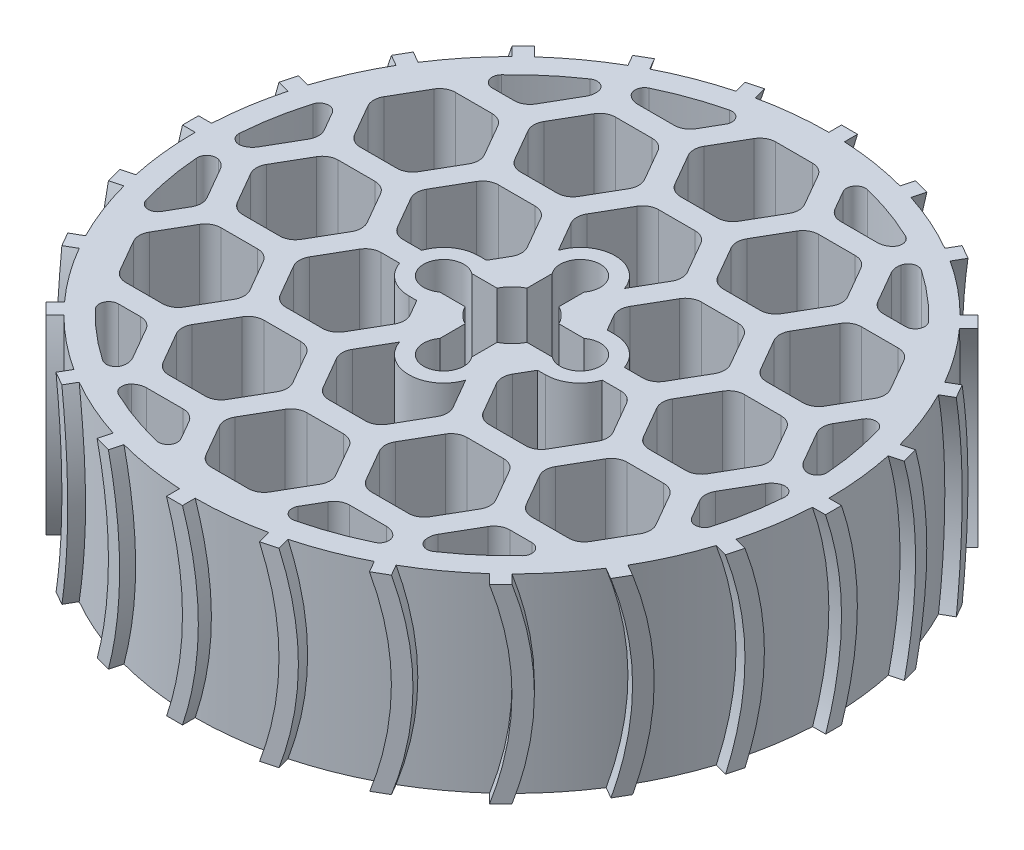
from build123d import *

# Parameters (mm, degrees)
SKETCH3_R           = 100
BOSS_EXTRUDE1_DEPTH = 60
SKETCH3_3_R         = 6.338999989
SKETCH3_3_R_2       = 3.302
BOSS_EXTRUDE2_DEPTH = 30
FILLET2_R           = 3
BOSS_EXTRUDE3_START = -2
BOSS_EXTRUDE3_DEPTH = 6
CIRPATTERN1_COUNT   = 24


with BuildPart() as part:
    # Sketch3 → Boss-Extrude1 (new body)
    with BuildSketch(Plane(origin=(0, 0, 0), x_dir=(1, 0, 0), z_dir=(0, 1, 0))):
        Circle(SKETCH3_R)
        with BuildLine():
            Line((9.767988863, 5.058299474), (17.727459802, 5.058299474))
            ThreePointArc((17.72745979, 5.05829949), (27.886999941, 1.2e-08), (17.727459809, -5.058299505))
            Line((17.727459783, -5.05829954), (9.767988829, -5.05829954))
            ThreePointArc((9.767988829, -5.05829954), (7.778174567, -7.778174619), (5.058299474, -9.767988863))
            Line((5.058299474, -9.767988863), (5.058299474, -17.727459802))
            ThreePointArc((5.05829949, -17.72745979), (1.2e-08, -27.886999941), (-5.058299505, -17.727459809))
            Line((-5.05829954, -17.727459783), (-5.05829954, -9.767988829))
            ThreePointArc((-5.05829954, -9.767988829), (-7.778174619, -7.778174567), (-9.767988863, -5.058299474))
            Line((-9.767988863, -5.058299474), (-17.727459802, -5.058299474))
            ThreePointArc((-17.72745979, -5.05829949), (-27.886999941, -1.2e-08), (-17.727459809, 5.058299505))
            Line((-17.727459783, 5.05829954), (-9.767988829, 5.05829954))
            ThreePointArc((-9.767988829, 5.05829954), (-7.778174567, 7.778174619), (-5.058299474, 9.767988863))
            Line((-5.058299474, 9.767988863), (-5.058299474, 17.727459802))
            ThreePointArc((-5.05829949, 17.72745979), (-1.2e-08, 27.886999941), (5.058299505, 17.727459809))
            Line((5.05829954, 17.727459783), (5.05829954, 9.767988829))
            ThreePointArc((5.05829954, 9.767988829), (7.778174619, 7.778174567), (9.767988863, 5.058299474))
        make_face(mode=Mode.SUBTRACT)
        with BuildLine():
            ThreePointArc((10.425269447, 25.057096364), (-7e-09, 32.547999916), (-10.425269391, 25.057096268))
            Line((-10.425269391, 25.057096268), (-15.877132403, 34.5))
            ThreePointArc((-15.877132403, 34.5), (-16.547005384, 37), (-15.877132403, 39.5))
            Line((-15.877132403, 39.5), (-10.103629711, 49.5))
            ThreePointArc((-10.103629711, 49.5), (-8.273502692, 51.330127019), (-5.773502692, 52))
            Line((-5.773502692, 52), (5.773502692, 52))
            ThreePointArc((5.773502692, 52), (8.273502692, 51.330127019), (10.103629711, 49.5))
            Line((10.103629711, 49.5), (15.877132403, 39.5))
            ThreePointArc((15.877132403, 39.5), (16.547005384, 37), (15.877132403, 34.5))
            Line((15.877132403, 34.5), (10.425269447, 25.057096364))
        make_face(mode=Mode.SUBTRACT)
        with BuildLine():
            ThreePointArc((86.025190109, 31), (86.543723708, 31.736009208), (87.185842375, 32.367095782))
            ThreePointArc((87.185842375, 32.367095782), (91.209249511, 18.162400823), (92.934116448, 3.5))
            Line((92.934116448, 3.5), (90.355317128, 3.5))
            ThreePointArc((90.355317128, 3.5), (87.855317128, 4.169872981), (86.025190109, 6))
            Line((86.025190109, 6), (80.251687417, 16))
            ThreePointArc((80.251687417, 16), (79.581814436, 18.5), (80.251687417, 21))
            Line((80.251687417, 21), (86.025190109, 31))
        make_face(mode=Mode.SUBTRACT)
        with BuildLine():
            Line((90.355317128, -3.5), (92.934116448, -3.5))
            ThreePointArc((92.934116448, -3.5), (91.209249511, -18.162400823), (87.185842375, -32.367095782))
            ThreePointArc((87.185842375, -32.367095782), (86.543723707, -31.736009208), (86.025190109, -31))
            Line((86.025190109, -31), (80.251687417, -21))
            ThreePointArc((80.251687417, -21), (79.581814436, -18.5), (80.251687417, -16))
            Line((80.251687417, -16), (86.025190109, -6))
            ThreePointArc((86.025190109, -6), (87.855317128, -4.169872981), (90.355317128, -3.5))
        make_face(mode=Mode.SUBTRACT)
        with BuildLine():
            ThreePointArc((69.859382572, -59), (70.756052043, -59.081058665), (71.623648382, -59.321606456))
            ThreePointArc((71.623648382, -59.321606456), (61.333725262, -69.908326725), (49.498147137, -78.733305722))
            Line((49.498147137, -78.733305722), (48.208747477, -76.5))
            ThreePointArc((48.208747477, -76.5), (47.538874496, -74), (48.208747477, -71.5))
            Line((48.208747477, -71.5), (53.982250169, -61.5))
            ThreePointArc((53.982250169, -61.5), (55.812377188, -59.669872981), (58.312377188, -59))
            Line((58.312377188, -59), (69.859382572, -59))
        make_face(mode=Mode.SUBTRACT)
        with BuildLine():
            Line((42.146569651, -80), (43.435969311, -82.233305722))
            ThreePointArc((43.435969311, -82.233305722), (29.875524249, -88.070727548), (15.562193993, -91.688702238))
            ThreePointArc((15.562193993, -91.688702238), (15.787671665, -90.817067873), (16.165807537, -90))
            Line((16.165807537, -90), (21.939310229, -80))
            ThreePointArc((21.939310229, -80), (23.769437248, -78.169872981), (26.269437248, -77.5))
            Line((26.269437248, -77.5), (37.816442632, -77.5))
            ThreePointArc((37.816442632, -77.5), (40.316442632, -78.169872981), (42.146569651, -80))
        make_face(mode=Mode.SUBTRACT)
        with BuildLine():
            ThreePointArc((-16.165807537, -90), (-15.787671665, -90.817067873), (-15.562193993, -91.688702238))
            ThreePointArc((-15.562193993, -91.688702238), (-29.875524249, -88.070727548), (-43.435969311, -82.233305722))
            Line((-43.435969311, -82.233305722), (-42.146569651, -80))
            ThreePointArc((-42.146569651, -80), (-40.316442632, -78.169872981), (-37.816442632, -77.5))
            Line((-37.816442632, -77.5), (-26.269437248, -77.5))
            ThreePointArc((-26.269437248, -77.5), (-23.769437248, -78.169872981), (-21.939310229, -80))
            Line((-21.939310229, -80), (-16.165807537, -90))
        make_face(mode=Mode.SUBTRACT)
        with BuildLine():
            Line((-48.208747477, -76.5), (-49.498147137, -78.733305722))
            ThreePointArc((-49.498147137, -78.733305722), (-61.333725262, -69.908326725), (-71.623648382, -59.321606456))
            ThreePointArc((-71.623648382, -59.321606456), (-70.756052043, -59.081058665), (-69.859382572, -59))
            Line((-69.859382572, -59), (-58.312377188, -59))
            ThreePointArc((-58.312377188, -59), (-55.812377188, -59.669872981), (-53.982250169, -61.5))
            Line((-53.982250169, -61.5), (-48.208747477, -71.5))
            ThreePointArc((-48.208747477, -71.5), (-47.538874496, -74), (-48.208747477, -76.5))
        make_face(mode=Mode.SUBTRACT)
        with BuildLine():
            ThreePointArc((-86.025190109, -31), (-86.543723708, -31.736009208), (-87.185842375, -32.367095782))
            ThreePointArc((-87.185842375, -32.367095782), (-91.209249511, -18.162400823), (-92.934116448, -3.5))
            Line((-92.934116448, -3.5), (-90.355317128, -3.5))
            ThreePointArc((-90.355317128, -3.5), (-87.855317128, -4.169872981), (-86.025190109, -6))
            Line((-86.025190109, -6), (-80.251687417, -16))
            ThreePointArc((-80.251687417, -16), (-79.581814436, -18.5), (-80.251687417, -21))
            Line((-80.251687417, -21), (-86.025190109, -31))
        make_face(mode=Mode.SUBTRACT)
        with BuildLine():
            Line((-90.355317128, 3.5), (-92.934116448, 3.5))
            ThreePointArc((-92.934116448, 3.5), (-91.209249511, 18.162400823), (-87.185842375, 32.367095782))
            ThreePointArc((-87.185842375, 32.367095782), (-86.543723707, 31.736009208), (-86.025190109, 31))
            Line((-86.025190109, 31), (-80.251687417, 21))
            ThreePointArc((-80.251687417, 21), (-79.581814436, 18.5), (-80.251687417, 16))
            Line((-80.251687417, 16), (-86.025190109, 6))
            ThreePointArc((-86.025190109, 6), (-87.855317128, 4.169872981), (-90.355317128, 3.5))
        make_face(mode=Mode.SUBTRACT)
        with BuildLine():
            ThreePointArc((-69.859382572, 59), (-70.756052043, 59.081058665), (-71.623648382, 59.321606456))
            ThreePointArc((-71.623648382, 59.321606456), (-61.333725262, 69.908326725), (-49.498147137, 78.733305722))
            Line((-49.498147137, 78.733305722), (-48.208747477, 76.5))
            ThreePointArc((-48.208747477, 76.5), (-47.538874496, 74), (-48.208747477, 71.5))
            Line((-48.208747477, 71.5), (-53.982250169, 61.5))
            ThreePointArc((-53.982250169, 61.5), (-55.812377188, 59.669872981), (-58.312377188, 59))
            Line((-58.312377188, 59), (-69.859382572, 59))
        make_face(mode=Mode.SUBTRACT)
        with BuildLine():
            Line((-42.146569651, 80), (-43.435969311, 82.233305722))
            ThreePointArc((-43.435969311, 82.233305722), (-29.875524249, 88.070727548), (-15.562193993, 91.688702238))
            ThreePointArc((-15.562193993, 91.688702238), (-15.787671665, 90.817067873), (-16.165807537, 90))
            Line((-16.165807537, 90), (-21.939310229, 80))
            ThreePointArc((-21.939310229, 80), (-23.769437248, 78.169872981), (-26.269437248, 77.5))
            Line((-26.269437248, 77.5), (-37.816442632, 77.5))
            ThreePointArc((-37.816442632, 77.5), (-40.316442632, 78.169872981), (-42.146569651, 80))
        make_face(mode=Mode.SUBTRACT)
        with BuildLine():
            ThreePointArc((16.165807537, 90), (15.787671665, 90.817067873), (15.562193993, 91.688702238))
            ThreePointArc((15.562193993, 91.688702238), (29.875524249, 88.070727548), (43.435969311, 82.233305722))
            Line((43.435969311, 82.233305722), (42.146569651, 80))
            ThreePointArc((42.146569651, 80), (40.316442632, 78.169872981), (37.816442632, 77.5))
            Line((37.816442632, 77.5), (26.269437248, 77.5))
            ThreePointArc((26.269437248, 77.5), (23.769437248, 78.169872981), (21.939310229, 80))
            Line((21.939310229, 80), (16.165807537, 90))
        make_face(mode=Mode.SUBTRACT)
        with BuildLine():
            Line((48.208747477, 76.5), (49.498147137, 78.733305722))
            ThreePointArc((49.498147137, 78.733305722), (61.333725262, 69.908326725), (71.623648382, 59.321606456))
            ThreePointArc((71.623648382, 59.321606456), (70.756052043, 59.081058665), (69.859382572, 59))
            Line((69.859382572, 59), (58.312377188, 59))
            ThreePointArc((58.312377188, 59), (55.812377188, 59.669872981), (53.982250169, 61.5))
            Line((53.982250169, 61.5), (48.208747477, 71.5))
            ThreePointArc((48.208747477, 71.5), (47.538874496, 74), (48.208747477, 76.5))
        make_face(mode=Mode.SUBTRACT)
        with BuildLine():
            Line((-26.269437248, -70.5), (-37.816442632, -70.5))
            ThreePointArc((-37.816442632, -70.5), (-40.316442632, -69.830127019), (-42.146569651, -68))
            Line((-42.146569651, -68), (-47.920072343, -58))
            ThreePointArc((-47.920072343, -58), (-48.589945324, -55.5), (-47.920072343, -53))
            Line((-47.920072343, -53), (-42.146569651, -43))
            ThreePointArc((-42.146569651, -43), (-40.316442632, -41.169872981), (-37.816442632, -40.5))
            Line((-37.816442632, -40.5), (-26.269437248, -40.5))
            ThreePointArc((-26.269437248, -40.5), (-23.769437248, -41.169872981), (-21.939310229, -43))
            Line((-21.939310229, -43), (-16.165807537, -53))
            ThreePointArc((-16.165807537, -53), (-15.495934556, -55.5), (-16.165807537, -58))
            Line((-16.165807537, -58), (-21.939310229, -68))
            ThreePointArc((-21.939310229, -68), (-23.769437248, -69.830127019), (-26.269437248, -70.5))
        make_face(mode=Mode.SUBTRACT)
        with BuildLine():
            Line((15.877132403, -76.5), (10.103629711, -86.5))
            ThreePointArc((10.103629711, -86.5), (8.273502692, -88.330127019), (5.773502692, -89))
            Line((5.773502692, -89), (-5.773502692, -89))
            ThreePointArc((-5.773502692, -89), (-8.273502692, -88.330127019), (-10.103629711, -86.5))
            Line((-10.103629711, -86.5), (-15.877132403, -76.5))
            ThreePointArc((-15.877132403, -76.5), (-16.547005384, -74), (-15.877132403, -71.5))
            Line((-15.877132403, -71.5), (-10.103629711, -61.5))
            ThreePointArc((-10.103629711, -61.5), (-8.273502692, -59.669872981), (-5.773502692, -59))
            Line((-5.773502692, -59), (5.773502692, -59))
            ThreePointArc((5.773502692, -59), (8.273502692, -59.669872981), (10.103629711, -61.5))
            Line((10.103629711, -61.5), (15.877132403, -71.5))
            ThreePointArc((15.877132403, -71.5), (16.547005384, -74), (15.877132403, -76.5))
        make_face(mode=Mode.SUBTRACT)
        with BuildLine():
            Line((-58.312377188, -52), (-69.859382572, -52))
            ThreePointArc((-69.859382572, -52), (-72.359382572, -51.330127019), (-74.189509591, -49.5))
            Line((-74.189509591, -49.5), (-79.963012283, -39.5))
            ThreePointArc((-79.963012283, -39.5), (-80.632885264, -37), (-79.963012283, -34.5))
            Line((-79.963012283, -34.5), (-74.189509591, -24.5))
            ThreePointArc((-74.189509591, -24.5), (-72.359382572, -22.669872981), (-69.859382572, -22))
            Line((-69.859382572, -22), (-58.312377188, -22))
            ThreePointArc((-58.312377188, -22), (-55.812377188, -22.669872981), (-53.982250169, -24.5))
            Line((-53.982250169, -24.5), (-48.208747477, -34.5))
            ThreePointArc((-48.208747477, -34.5), (-47.538874496, -37), (-48.208747477, -39.5))
            Line((-48.208747477, -39.5), (-53.982250169, -49.5))
            ThreePointArc((-53.982250169, -49.5), (-55.812377188, -51.330127019), (-58.312377188, -52))
        make_face(mode=Mode.SUBTRACT)
        with BuildLine():
            Line((-74.189509591, -12.5), (-79.963012283, -2.5))
            ThreePointArc((-79.963012283, -2.5), (-80.632885264, 0), (-79.963012283, 2.5))
            Line((-79.963012283, 2.5), (-74.189509591, 12.5))
            ThreePointArc((-74.189509591, 12.5), (-72.359382572, 14.330127019), (-69.859382572, 15))
            Line((-69.859382572, 15), (-58.312377188, 15))
            ThreePointArc((-58.312377188, 15), (-55.812377188, 14.330127019), (-53.982250169, 12.5))
            Line((-53.982250169, 12.5), (-48.208747477, 2.5))
            ThreePointArc((-48.208747477, 2.5), (-47.538874496, 0), (-48.208747477, -2.5))
            Line((-48.208747477, -2.5), (-53.982250169, -12.5))
            ThreePointArc((-53.982250169, -12.5), (-55.812377188, -14.330127019), (-58.312377188, -15))
            Line((-58.312377188, -15), (-69.859382572, -15))
            ThreePointArc((-69.859382572, -15), (-72.359382572, -14.330127019), (-74.189509591, -12.5))
        make_face(mode=Mode.SUBTRACT)
        with BuildLine():
            Line((47.920072343, -58), (42.146569651, -68))
            ThreePointArc((42.146569651, -68), (40.316442632, -69.830127019), (37.816442632, -70.5))
            Line((37.816442632, -70.5), (26.269437248, -70.5))
            ThreePointArc((26.269437248, -70.5), (23.769437248, -69.830127019), (21.939310229, -68))
            Line((21.939310229, -68), (16.165807537, -58))
            ThreePointArc((16.165807537, -58), (15.495934556, -55.5), (16.165807537, -53))
            Line((16.165807537, -53), (21.939310229, -43))
            ThreePointArc((21.939310229, -43), (23.769437248, -41.169872981), (26.269437248, -40.5))
            Line((26.269437248, -40.5), (37.816442632, -40.5))
            ThreePointArc((37.816442632, -40.5), (40.316442632, -41.169872981), (42.146569651, -43))
            Line((42.146569651, -43), (47.920072343, -53))
            ThreePointArc((47.920072343, -53), (48.589945324, -55.5), (47.920072343, -58))
        make_face(mode=Mode.SUBTRACT)
        with BuildLine():
            ThreePointArc((79.963012283, 39.5), (80.632885264, 37), (79.963012283, 34.5))
            Line((79.963012283, 34.5), (74.189509591, 24.5))
            ThreePointArc((74.189509591, 24.5), (72.359382572, 22.669872981), (69.859382572, 22))
            Line((69.859382572, 22), (58.312377188, 22))
            ThreePointArc((58.312377188, 22), (55.812377188, 22.669872981), (53.982250169, 24.5))
            Line((53.982250169, 24.5), (48.208747477, 34.5))
            ThreePointArc((48.208747477, 34.5), (47.538874496, 37), (48.208747477, 39.5))
            Line((48.208747477, 39.5), (53.982250169, 49.5))
            ThreePointArc((53.982250169, 49.5), (55.812377188, 51.330127019), (58.312377188, 52))
            Line((58.312377188, 52), (69.859382572, 52))
            ThreePointArc((69.859382572, 52), (72.359382572, 51.330127019), (74.189509591, 49.5))
            Line((74.189509591, 49.5), (79.963012283, 39.5))
        make_face(mode=Mode.SUBTRACT)
        with BuildLine():
            Line((-16.165807537, 16), (-19.052558858, 11.000000044))
            Line((-19.052558858, 11.000000044), (-21.547999916, 11.000000044))
            ThreePointArc((-21.547999916, 11.000000044), (-27.970616224, 8.93028558), (-31.976326738, 3.5))
            Line((-31.976326738, 3.5), (-37.816442632, 3.5))
            ThreePointArc((-37.816442632, 3.5), (-40.316442632, 4.169872981), (-42.146569651, 6))
            Line((-42.146569651, 6), (-47.920072343, 16))
            ThreePointArc((-47.920072343, 16), (-48.589945324, 18.5), (-47.920072343, 21))
            Line((-47.920072343, 21), (-42.146569651, 31))
            ThreePointArc((-42.146569651, 31), (-40.316442632, 32.830127019), (-37.816442632, 33.5))
            Line((-37.816442632, 33.5), (-26.269437248, 33.5))
            ThreePointArc((-26.269437248, 33.5), (-23.769437248, 32.830127019), (-21.939310229, 31))
            Line((-21.939310229, 31), (-16.165807537, 21))
            ThreePointArc((-16.165807537, 21), (-15.495934556, 18.5), (-16.165807537, 16))
        make_face(mode=Mode.SUBTRACT)
        with BuildLine():
            Line((-37.816442632, -3.5), (-31.976326709, -3.5))
            ThreePointArc((-31.976326709, -3.5), (-27.970616186, -8.930285519), (-21.547999916, -10.999999956))
            Line((-21.547999916, -10.999999956), (-19.052558909, -10.999999956))
            Line((-19.052558909, -10.999999956), (-16.165807537, -16))
            ThreePointArc((-16.165807537, -16), (-15.495934556, -18.5), (-16.165807537, -21))
            Line((-16.165807537, -21), (-21.939310229, -31))
            ThreePointArc((-21.939310229, -31), (-23.769437248, -32.830127019), (-26.269437248, -33.5))
            Line((-26.269437248, -33.5), (-37.816442632, -33.5))
            ThreePointArc((-37.816442632, -33.5), (-40.316442632, -32.830127019), (-42.146569651, -31))
            Line((-42.146569651, -31), (-47.920072343, -21))
            ThreePointArc((-47.920072343, -21), (-48.589945324, -18.5), (-47.920072343, -16))
            Line((-47.920072343, -16), (-42.146569651, -6))
            ThreePointArc((-42.146569651, -6), (-40.316442632, -4.169872981), (-37.816442632, -3.5))
        make_face(mode=Mode.SUBTRACT)
        with BuildLine():
            Line((-15.877132403, -34.5), (-10.425269447, -25.057096364))
            ThreePointArc((-10.425269447, -25.057096364), (7e-09, -32.547999916), (10.425269391, -25.057096268))
            Line((10.425269391, -25.057096268), (15.877132403, -34.5))
            ThreePointArc((15.877132403, -34.5), (16.547005384, -37), (15.877132403, -39.5))
            Line((15.877132403, -39.5), (10.103629711, -49.5))
            ThreePointArc((10.103629711, -49.5), (8.273502692, -51.330127019), (5.773502692, -52))
            Line((5.773502692, -52), (-5.773502692, -52))
            ThreePointArc((-5.773502692, -52), (-8.273502692, -51.330127019), (-10.103629711, -49.5))
            Line((-10.103629711, -49.5), (-15.877132403, -39.5))
            ThreePointArc((-15.877132403, -39.5), (-16.547005384, -37), (-15.877132403, -34.5))
        make_face(mode=Mode.SUBTRACT)
        with BuildLine():
            Line((16.165807537, -16), (19.052558858, -11.000000044))
            Line((19.052558858, -11.000000044), (21.547999916, -11.000000044))
            ThreePointArc((21.547999916, -11.000000044), (27.970616224, -8.93028558), (31.976326738, -3.5))
            Line((31.976326738, -3.5), (37.816442632, -3.5))
            ThreePointArc((37.816442632, -3.5), (40.316442632, -4.169872981), (42.146569651, -6))
            Line((42.146569651, -6), (47.920072343, -16))
            ThreePointArc((47.920072343, -16), (48.589945324, -18.5), (47.920072343, -21))
            Line((47.920072343, -21), (42.146569651, -31))
            ThreePointArc((42.146569651, -31), (40.316442632, -32.830127019), (37.816442632, -33.5))
            Line((37.816442632, -33.5), (26.269437248, -33.5))
            ThreePointArc((26.269437248, -33.5), (23.769437248, -32.830127019), (21.939310229, -31))
            Line((21.939310229, -31), (16.165807537, -21))
            ThreePointArc((16.165807537, -21), (15.495934556, -18.5), (16.165807537, -16))
        make_face(mode=Mode.SUBTRACT)
        with BuildLine():
            Line((37.816442632, 3.5), (31.976326709, 3.5))
            ThreePointArc((31.976326709, 3.5), (27.970616186, 8.930285519), (21.547999916, 10.999999956))
            Line((21.547999916, 10.999999956), (19.052558909, 10.999999956))
            Line((19.052558909, 10.999999956), (16.165807537, 16))
            ThreePointArc((16.165807537, 16), (15.495934556, 18.5), (16.165807537, 21))
            Line((16.165807537, 21), (21.939310229, 31))
            ThreePointArc((21.939310229, 31), (23.769437248, 32.830127019), (26.269437248, 33.5))
            Line((26.269437248, 33.5), (37.816442632, 33.5))
            ThreePointArc((37.816442632, 33.5), (40.316442632, 32.830127019), (42.146569651, 31))
            Line((42.146569651, 31), (47.920072343, 21))
            ThreePointArc((47.920072343, 21), (48.589945324, 18.5), (47.920072343, 16))
            Line((47.920072343, 16), (42.146569651, 6))
            ThreePointArc((42.146569651, 6), (40.316442632, 4.169872981), (37.816442632, 3.5))
        make_face(mode=Mode.SUBTRACT)
        with BuildLine():
            Line((74.189509591, -24.5), (79.963012283, -34.5))
            ThreePointArc((79.963012283, -34.5), (80.632885264, -37), (79.963012283, -39.5))
            Line((79.963012283, -39.5), (74.189509591, -49.5))
            ThreePointArc((74.189509591, -49.5), (72.359382572, -51.330127019), (69.859382572, -52))
            Line((69.859382572, -52), (58.312377188, -52))
            ThreePointArc((58.312377188, -52), (55.812377188, -51.330127019), (53.982250169, -49.5))
            Line((53.982250169, -49.5), (48.208747477, -39.5))
            ThreePointArc((48.208747477, -39.5), (47.538874496, -37), (48.208747477, -34.5))
            Line((48.208747477, -34.5), (53.982250169, -24.5))
            ThreePointArc((53.982250169, -24.5), (55.812377188, -22.669872981), (58.312377188, -22))
            Line((58.312377188, -22), (69.859382572, -22))
            ThreePointArc((69.859382572, -22), (72.359382572, -22.669872981), (74.189509591, -24.5))
        make_face(mode=Mode.SUBTRACT)
        with BuildLine():
            Line((74.189509591, 12.5), (79.963012283, 2.5))
            ThreePointArc((79.963012283, 2.5), (80.632885264, 0), (79.963012283, -2.5))
            Line((79.963012283, -2.5), (74.189509591, -12.5))
            ThreePointArc((74.189509591, -12.5), (72.359382572, -14.330127019), (69.859382572, -15))
            Line((69.859382572, -15), (58.312377188, -15))
            ThreePointArc((58.312377188, -15), (55.812377188, -14.330127019), (53.982250169, -12.5))
            Line((53.982250169, -12.5), (48.208747477, -2.5))
            ThreePointArc((48.208747477, -2.5), (47.538874496, 0), (48.208747477, 2.5))
            Line((48.208747477, 2.5), (53.982250169, 12.5))
            ThreePointArc((53.982250169, 12.5), (55.812377188, 14.330127019), (58.312377188, 15))
            Line((58.312377188, 15), (69.859382572, 15))
            ThreePointArc((69.859382572, 15), (72.359382572, 14.330127019), (74.189509591, 12.5))
        make_face(mode=Mode.SUBTRACT)
        with BuildLine():
            Line((-74.189509591, 24.5), (-79.963012283, 34.5))
            ThreePointArc((-79.963012283, 34.5), (-80.632885264, 37), (-79.963012283, 39.5))
            Line((-79.963012283, 39.5), (-74.189509591, 49.5))
            ThreePointArc((-74.189509591, 49.5), (-72.359382572, 51.330127019), (-69.859382572, 52))
            Line((-69.859382572, 52), (-58.312377188, 52))
            ThreePointArc((-58.312377188, 52), (-55.812377188, 51.330127019), (-53.982250169, 49.5))
            Line((-53.982250169, 49.5), (-48.208747477, 39.5))
            ThreePointArc((-48.208747477, 39.5), (-47.538874496, 37), (-48.208747477, 34.5))
            Line((-48.208747477, 34.5), (-53.982250169, 24.5))
            ThreePointArc((-53.982250169, 24.5), (-55.812377188, 22.669872981), (-58.312377188, 22))
            Line((-58.312377188, 22), (-69.859382572, 22))
            ThreePointArc((-69.859382572, 22), (-72.359382572, 22.669872981), (-74.189509591, 24.5))
        make_face(mode=Mode.SUBTRACT)
        with BuildLine():
            Line((-47.920072343, 58), (-42.146569651, 68))
            ThreePointArc((-42.146569651, 68), (-40.316442632, 69.830127019), (-37.816442632, 70.5))
            Line((-37.816442632, 70.5), (-26.269437248, 70.5))
            ThreePointArc((-26.269437248, 70.5), (-23.769437248, 69.830127019), (-21.939310229, 68))
            Line((-21.939310229, 68), (-16.165807537, 58))
            ThreePointArc((-16.165807537, 58), (-15.495934556, 55.5), (-16.165807537, 53))
            Line((-16.165807537, 53), (-21.939310229, 43))
            ThreePointArc((-21.939310229, 43), (-23.769437248, 41.169872981), (-26.269437248, 40.5))
            Line((-26.269437248, 40.5), (-37.816442632, 40.5))
            ThreePointArc((-37.816442632, 40.5), (-40.316442632, 41.169872981), (-42.146569651, 43))
            Line((-42.146569651, 43), (-47.920072343, 53))
            ThreePointArc((-47.920072343, 53), (-48.589945324, 55.5), (-47.920072343, 58))
        make_face(mode=Mode.SUBTRACT)
        with BuildLine():
            Line((26.269437248, 70.5), (37.816442632, 70.5))
            ThreePointArc((37.816442632, 70.5), (40.316442632, 69.830127019), (42.146569651, 68))
            Line((42.146569651, 68), (47.920072343, 58))
            ThreePointArc((47.920072343, 58), (48.589945324, 55.5), (47.920072343, 53))
            Line((47.920072343, 53), (42.146569651, 43))
            ThreePointArc((42.146569651, 43), (40.316442632, 41.169872981), (37.816442632, 40.5))
            Line((37.816442632, 40.5), (26.269437248, 40.5))
            ThreePointArc((26.269437248, 40.5), (23.769437248, 41.169872981), (21.939310229, 43))
            Line((21.939310229, 43), (16.165807537, 53))
            ThreePointArc((16.165807537, 53), (15.495934556, 55.5), (16.165807537, 58))
            Line((16.165807537, 58), (21.939310229, 68))
            ThreePointArc((21.939310229, 68), (23.769437248, 69.830127019), (26.269437248, 70.5))
        make_face(mode=Mode.SUBTRACT)
        with BuildLine():
            Line((-5.773502692, 89), (5.773502692, 89))
            ThreePointArc((5.773502692, 89), (8.273502692, 88.330127019), (10.103629711, 86.5))
            Line((10.103629711, 86.5), (15.877132403, 76.5))
            ThreePointArc((15.877132403, 76.5), (16.547005384, 74), (15.877132403, 71.5))
            Line((15.877132403, 71.5), (10.103629711, 61.5))
            ThreePointArc((10.103629711, 61.5), (8.273502692, 59.669872981), (5.773502692, 59))
            Line((5.773502692, 59), (-5.773502692, 59))
            ThreePointArc((-5.773502692, 59), (-8.273502692, 59.669872981), (-10.103629711, 61.5))
            Line((-10.103629711, 61.5), (-15.877132403, 71.5))
            ThreePointArc((-15.877132403, 71.5), (-16.547005384, 74), (-15.877132403, 76.5))
            Line((-15.877132403, 76.5), (-10.103629711, 86.5))
            ThreePointArc((-10.103629711, 86.5), (-8.273502692, 88.330127019), (-5.773502692, 89))
        make_face(mode=Mode.SUBTRACT)
    extrude(amount=BOSS_EXTRUDE1_DEPTH)

    # Sketch3<3> → Boss-Extrude2 (add)
    # profile 1 of 4: a face of its own
    with BuildSketch(Plane(origin=(0, 0, 0), x_dir=(1, 0, 0), z_dir=(0, 1, 0))):
        with Locations((0, 21.547999952)):
            Circle(SKETCH3_3_R)
        with Locations((4.4e-08, 21.547999942)):
            Circle(SKETCH3_3_R_2, mode=Mode.SUBTRACT)
    # profile 2 of 4: a face of its own
    with BuildSketch(Plane(origin=(0, 0, 0), x_dir=(1, 0, 0), z_dir=(0, 1, 0))):
        with Locations((21.547999952, 0)):
            Circle(SKETCH3_3_R)
        with Locations((21.547999942, -4.4e-08)):
            Circle(SKETCH3_3_R_2, mode=Mode.SUBTRACT)
    # profile 3 of 4: a face of its own
    with BuildSketch(Plane(origin=(0, 0, 0), x_dir=(1, 0, 0), z_dir=(0, 1, 0))):
        with Locations((-21.547999952, 0)):
            Circle(SKETCH3_3_R)
        with Locations((-21.547999942, 4.4e-08)):
            Circle(SKETCH3_3_R_2, mode=Mode.SUBTRACT)
    # profile 4 of 4: a face of its own
    with BuildSketch(Plane(origin=(0, 0, 0), x_dir=(1, 0, 0), z_dir=(0, 1, 0))):
        with Locations((0, -21.547999952)):
            Circle(SKETCH3_3_R)
        with Locations((-4.4e-08, -21.547999942)):
            Circle(SKETCH3_3_R_2, mode=Mode.SUBTRACT)
    extrude(amount=BOSS_EXTRUDE2_DEPTH)

    # Fillet2
    fillet2_edges = [part.edges().sort_by_distance(p)[0] for p in [
        (92.934116448, 30, -3.5),
        (87.185842375, 30, -32.367095782),
        (92.934116448, 30, 3.5),
        (87.185842375, 30, 32.367095782),
        (71.623648382, 30, 59.321606456),
        (49.498147137, 30, 78.733305722),
        (43.435969311, 30, 82.233305722),
        (15.562193993, 30, 91.688702238),
        (-15.562193993, 30, 91.688702238),
        (-43.435969311, 30, 82.233305722),
        (-49.498147137, 30, 78.733305722),
        (-71.623648382, 30, 59.321606456),
        (-87.185842375, 30, 32.367095782),
        (-92.934116448, 30, 3.5),
        (-92.934116448, 30, -3.5),
        (-87.185842375, 30, -32.367095782),
        (-43.435969311, 30, -82.233305722),
        (-49.498147137, 30, -78.733305722),
        (-71.623648382, 30, -59.321606456),
        (-15.562193993, 30, -91.688702238),
        (15.562193993, 30, -91.688702238),
        (43.435969311, 30, -82.233305722),
        (49.498147137, 30, -78.733305722),
        (71.623648382, 30, -59.321606456),
    ]]
    fillet(fillet2_edges, radius=FILLET2_R)

    # Sketch4 → Boss-Extrude3 (add)
    with BuildSketch(Plane(origin=(100, 0, 0), x_dir=(0, 0, -1), z_dir=(1, 0, 0)).offset(BOSS_EXTRUDE3_START)):
        with BuildLine():
            Line((-5, 0), (0, 0))
            add(Edge.make_bspline(
                [(0, 60), (10, 30), (0, 0)],
                knots=[0, 0, 0, 1, 1, 1], degree=2))
            Line((0, 60), (-5.05829954, 60))
            add(Edge.make_bspline(
                [(-5.05829954, 60), (5.029140786, 30.009506083), (-5, 0)],
                knots=[0, 0, 0, 1, 1, 1], degree=2))
        make_face()
    boss_extrude3 = extrude(amount=BOSS_EXTRUDE3_DEPTH)

    # CirPattern1: Boss-Extrude3 ×24 about axis
    cirpattern1_axis = Axis((0, 60, 0), (0, -1, 0))
    for i in range(1, CIRPATTERN1_COUNT):
        add(boss_extrude3.rotate(cirpattern1_axis, i * 360 / CIRPATTERN1_COUNT))


solid = part.part
